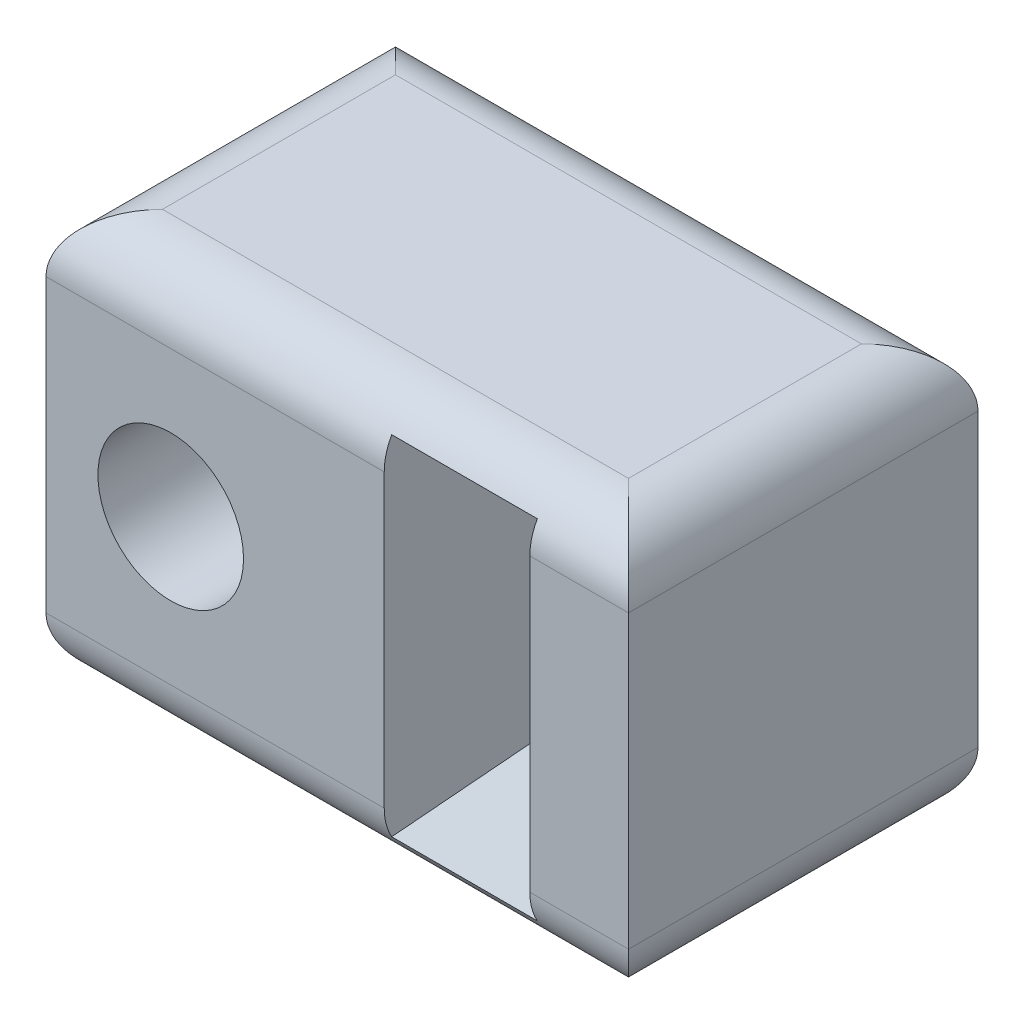
from build123d import *

# Parameters (mm, degrees)
SKETCH1_W           = 10
SKETCH1_H           = 7
BOSS_EXTRUDE1_DEPTH = 6
SKETCH4_R           = 1.25
CUT_EXTRUDE1_DEPTH  = 6
FILLET1_R           = 1


with BuildPart() as part:
    # Sketch1 → Boss-Extrude1 (new body)
    with BuildSketch(Plane.XY):
        Rectangle(SKETCH1_W, SKETCH1_H)
    extrude(amount=BOSS_EXTRUDE1_DEPTH)

    # Sketch3 → Cut-Loft2 section 0
    with BuildSketch(Plane(origin=(0, 0, 0), x_dir=(-1, 0, 0), z_dir=(0, 0, -1))):
        with BuildLine():
            Line((-3.306604223, -2.5), (-0.806604223, -2.5))
            Line((-0.806604223, -2.5), (-0.806604223, 2.5))
            Line((-0.806604223, 2.5), (-3.306604223, 2.5))
            Line((-3.306604223, 2.5), (-3.306604223, -2.5))
        make_face()
    # Sketch2 → Cut-Loft2 section 1
    with BuildSketch(Plane.XY.offset(6)):
        with BuildLine():
            Line((0.806604223, -3), (3.306604223, -3))
            Line((3.306604223, -3), (3.306604223, 3))
            Line((3.306604223, 3), (0.806604223, 3))
            Line((0.806604223, 3), (0.806604223, -3))
        make_face()
    loft(mode=Mode.SUBTRACT)

    # Sketch4 → Cut-Extrude1 (cut)
    with BuildSketch(Plane.XY.offset(6)):
        with Locations((-2.858867823, 0)):
            Circle(SKETCH4_R)
    extrude(amount=-CUT_EXTRUDE1_DEPTH, mode=Mode.SUBTRACT)

    # Fillet1
    # the kernel refuses this fillet: 1 mm, written as the material it takes off along each edge
    with BuildSketch(Plane(origin=(-7.5, -3.5, 0), x_dir=(0, 0, 1), z_dir=(1, 0, 0)), Plane(origin=(7.5, 3.5, 6), x_dir=(0, -1, 0), z_dir=(-1, 0, 0))) as fillet1_piece_1:
        with BuildLine():
            CenterArc((FILLET1_R, -FILLET1_R), FILLET1_R, 90, 90)
            Line((0, -FILLET1_R), (0, 0))
            Line((0, 0), (FILLET1_R, 0))
        make_face()
    extrude(amount=15, mode=Mode.SUBTRACT)
    with BuildSketch(Plane(origin=(7.5, 3.5, 0), x_dir=(0, -1, 0), z_dir=(-1, 0, 0)), Plane(origin=(-7.5, -3.5, 6), x_dir=(0, 0, -1), z_dir=(1, 0, 0))) as fillet1_piece_2:
        with BuildLine():
            CenterArc((FILLET1_R, FILLET1_R), FILLET1_R, 180, 90)
            Line((0, FILLET1_R), (0, 0))
            Line((0, 0), (FILLET1_R, 0))
        make_face()
    extrude(amount=15, mode=Mode.SUBTRACT)
    with BuildSketch(Plane(origin=(-5, -3.5, -2.5), x_dir=(1, 0, 0), z_dir=(0, 0, 1)), Plane(origin=(-5, 3.5, -2.5), x_dir=(0, -1, 0), z_dir=(0, 0, 1))) as fillet1_piece_3:
        with BuildLine():
            CenterArc((FILLET1_R, FILLET1_R), FILLET1_R, 180, 90)
            Line((0, FILLET1_R), (0, 0))
            Line((0, 0), (FILLET1_R, 0))
        make_face()
    extrude(amount=11, mode=Mode.SUBTRACT)
    with BuildSketch(Plane(origin=(5, -3.5, -2.5), x_dir=(-1, 0, 0), z_dir=(0, 0, 1)), Plane(origin=(5, 3.5, -2.5), x_dir=(0, -1, 0), z_dir=(0, 0, 1))) as fillet1_piece_4:
        with BuildLine():
            CenterArc((FILLET1_R, -FILLET1_R), FILLET1_R, 90, 90)
            Line((0, -FILLET1_R), (0, 0))
            Line((0, 0), (FILLET1_R, 0))
        make_face()
    extrude(amount=11, mode=Mode.SUBTRACT)


solid = part.part
